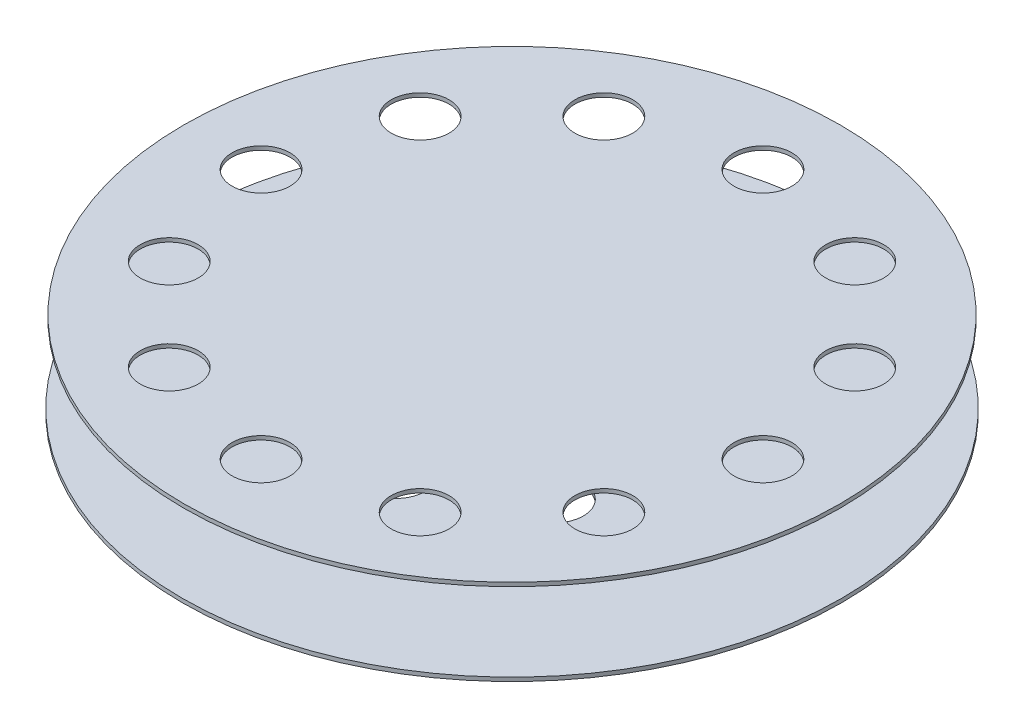
from build123d import *

# Parameters (mm, degrees)
SKETCH2_R          = 7.5
CUT_EXTRUDE1_DEPTH = 2
CIRPATTERN1_COUNT  = 12
SKETCH3_R          = 7.5
CUT_EXTRUDE2_DEPTH = 2
CIRPATTERN2_COUNT  = 6


with BuildPart() as part:
    # Sketch1 → Revolve1 (revolve)
    with BuildSketch(Plane.XY):
        Polygon((0, 62), (-84.99983, 62), (-84.99983, 61), (-5, 61), (-5, 41), (-85.40305253, 41), (-85.40305253, 40), (-5, 40), (-5, 0), (0, 0), align=None)
    revolve(axis=Axis((0, 54.874193188, 0), (0, -1, 0)))

    # Sketch2 → Cut-Extrude1 (cut)
    with BuildSketch(Plane(origin=(0, 62, 0), x_dir=(1, 0, 0), z_dir=(0, 1, 0))):
        with Locations((0, 65)):
            Circle(SKETCH2_R)
    cut_extrude1 = extrude(amount=-CUT_EXTRUDE1_DEPTH, mode=Mode.SUBTRACT)

    # CirPattern1: Cut-Extrude1 ×12 about axis
    cirpattern1_axis = Axis((0, 54.874193188, 0), (0, -1, 0))
    for i in range(1, CIRPATTERN1_COUNT):
        add(cut_extrude1.rotate(cirpattern1_axis, i * 360 / CIRPATTERN1_COUNT), mode=Mode.SUBTRACT)

    # Sketch3 → Cut-Extrude2 (cut)
    with BuildSketch(Plane.XZ.offset(-40)):
        with Locations((0, 30)):
            Circle(SKETCH3_R)
    cut_extrude2 = extrude(amount=-CUT_EXTRUDE2_DEPTH, mode=Mode.SUBTRACT)

    # CirPattern2: Cut-Extrude2 ×6 about axis
    cirpattern2_axis = Axis((0, 54.874193188, 0), (0, -1, 0))
    for i in range(1, CIRPATTERN2_COUNT):
        add(cut_extrude2.rotate(cirpattern2_axis, i * 360 / CIRPATTERN2_COUNT), mode=Mode.SUBTRACT)


solid = part.part
